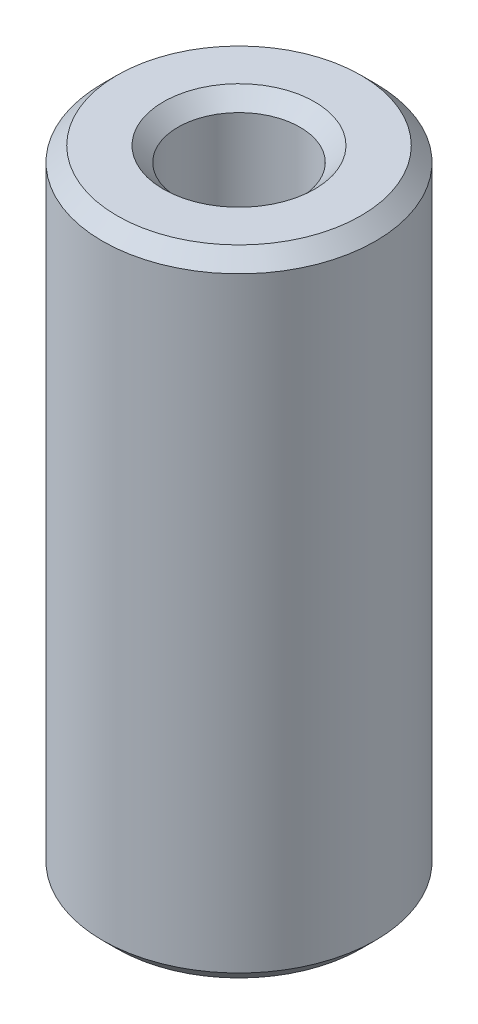
from build123d import *

# Parameters (mm, degrees)
SKETCH1_R           = 12.5
BOSS_EXTRUDE1_DEPTH = 58.139340442
SKETCH2_R           = 5.590053256
CUT_EXTRUDE1_DEPTH  = 61.767449404
CHAMFER1_SIZE       = 1.341678574


with BuildPart() as part:
    # Sketch1 → Boss-Extrude1 (new body)
    with BuildSketch(Plane(origin=(0, 0, 0), x_dir=(1, 0, 0), z_dir=(0, 1, 0))):
        Circle(SKETCH1_R)
    extrude(amount=BOSS_EXTRUDE1_DEPTH)

    # Sketch2 → Cut-Extrude1 (cut, through all)
    with BuildSketch(Plane(origin=(0, 0, 0), x_dir=(1, 0, 0), z_dir=(0, 1, 0))):
        Circle(SKETCH2_R)
    extrude(amount=CUT_EXTRUDE1_DEPTH, mode=Mode.SUBTRACT)

    # Chamfer1
    chamfer1_edges = [part.edges().sort_by_distance(p)[0] for p in [
        (-5.590053256, 58.139340442, 0),
        (-5.590053256, 0, 0),
        (-12.5, 0, 0),
        (-12.5, 58.139340442, 0),
    ]]
    chamfer(chamfer1_edges, length=CHAMFER1_SIZE)


solid = part.part
